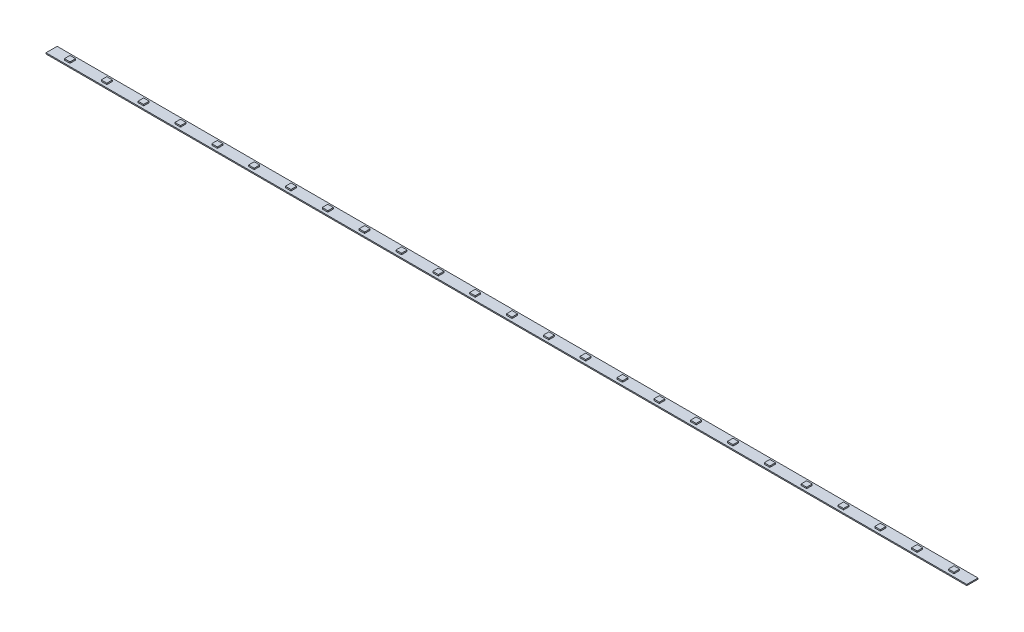
from build123d import *

# Parameters (mm, degrees)
SKETCH1_W            = 33
SKETCH1_H            = 10
BOSS_EXTRUDE1_DEPTH  = 1
SKETCH3_W            = 5
SKETCH3_H            = 5
BOSS_EXTRUDE2_DEPTH  = 1.2
LPATTERN1_COUNT      = 13
LPATTERN1_PITCH      = 33
LPATTERN1_COUNT_DIR2 = 13
LPATTERN1_PITCH_DIR2 = 33


with BuildPart() as part:
    # Sketch1 → Boss-Extrude1 (new body)
    with BuildSketch(Plane(origin=(0, 0, 0), x_dir=(1, 0, 0), z_dir=(0, 1, 0))):
        Rectangle(SKETCH1_W, SKETCH1_H)
    boss_extrude1 = extrude(amount=BOSS_EXTRUDE1_DEPTH)

    # Sketch3 → Boss-Extrude2 (add)
    with BuildSketch(Plane(origin=(0, 1, 0), x_dir=(1, 0, 0), z_dir=(0, 1, 0))):
        Rectangle(SKETCH3_W, SKETCH3_H)
    boss_extrude2 = extrude(amount=BOSS_EXTRUDE2_DEPTH)

    # LPattern1: Boss-Extrude1, Boss-Extrude2 13 × 13
    with Locations(*[Vector(-1, 0, 0) * (i * LPATTERN1_PITCH) + Vector(1, 0, 0) * (j * LPATTERN1_PITCH_DIR2) for i in range(LPATTERN1_COUNT) for j in range(LPATTERN1_COUNT_DIR2) if (i, j) != (0, 0)]):
        add(boss_extrude1)
        add(boss_extrude2)


solid = part.part
